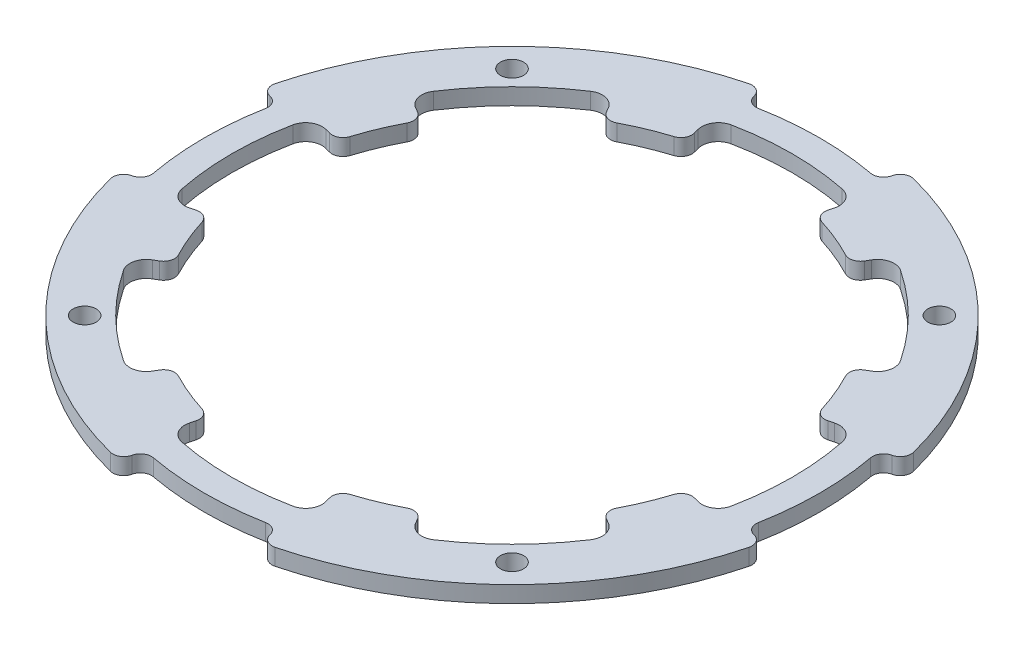
from build123d import *

# Parameters (mm, degrees)
SKETCH1_R                       = 60
SKETCH1_R_2                     = 45
BOSS_EXTRUDE1_DEPTH             = 3
CUT_EXTRUDE1_DEPTH              = 85.905830189
CIRPATTERN1_COUNT               = 8
SKETCH3_R                       = 2.1
CUT_EXTRUDE2_DEPTH              = 85.905830189
CIRPATTERN2_COUNT               = 4
SCHNITT_LINEAR_AUSTRAGEN1_DEPTH = 85.905830189
VERRUNDUNG2_R                   = 2
KREISMUSTER7_COUNT              = 4
VERRUNDUNG2_OF_KREISMUSTER7_R   = 2


with BuildPart() as part:
    # Sketch1 → Boss-Extrude1 (new body)
    with BuildSketch(Plane(origin=(0, 0, 0), x_dir=(1, 0, 0), z_dir=(0, 1, 0))):
        with Locations(Location((0, 0, 0), (0, 0, 270))):
            Circle(SKETCH1_R)
        with Locations(Location((0, 0, 0), (0, 0, 270))):
            Circle(SKETCH1_R_2, mode=Mode.SUBTRACT)
    extrude(amount=BOSS_EXTRUDE1_DEPTH)

    # Sketch2 → Cut-Extrude1 (cut, through all)
    with BuildSketch(Plane(origin=(0, 3, 0), x_dir=(1, 0, 0), z_dir=(0, 1, 0))):
        with BuildLine():
            Line((12.399026137, 46.273795509), (12.153476553, 45.357391985))
            ThreePointArc((12.153476553, 45.357391985), (12.332388249, 43.876840862), (13.485952537, 42.931679261))
            Line((13.485952537, 42.931679261), (-13.485952537, 42.931679261))
            ThreePointArc((-13.485952537, 42.931679261), (-12.332388249, 43.876840862), (-12.153476553, 45.357391985))
            Line((-12.153476553, 45.357391985), (-12.399026137, 46.273795509))
            ThreePointArc((-12.399026137, 46.273795509), (-12.051156799, 48.63074892), (-10.0950767, 49.990893435))
            ThreePointArc((-10.0950767, 49.990893435), (0, 51), (10.0950767, 49.990893435))
            ThreePointArc((10.0950767, 49.990893435), (12.051156799, 48.63074892), (12.399026137, 46.273795509))
        make_face()
    cut_extrude1 = extrude(amount=-CUT_EXTRUDE1_DEPTH, mode=Mode.SUBTRACT)

    # CirPattern1: Cut-Extrude1 ×8 about axis
    cirpattern1_axis = Axis((0, 0, 0), (0, 1, 0))
    for i in range(1, CIRPATTERN1_COUNT):
        add(cut_extrude1.rotate(cirpattern1_axis, i * 360 / CIRPATTERN1_COUNT), mode=Mode.SUBTRACT)

    # Sketch3 → Cut-Extrude2 (cut, through all)
    with BuildSketch(Plane(origin=(0, 3, 0), x_dir=(1, 0, 0), z_dir=(0, 1, 0))):
        with Locations(Location((38.890872965, 38.890872965, 0), (0, 0, 270))):
            Circle(SKETCH3_R)
    cut_extrude2 = extrude(amount=-CUT_EXTRUDE2_DEPTH, mode=Mode.SUBTRACT)

    # CirPattern2: Cut-Extrude2 ×4 about axis
    cirpattern2_axis = Axis((0, 0, 0), (0, 1, 0))
    for i in range(1, CIRPATTERN2_COUNT):
        add(cut_extrude2.rotate(cirpattern2_axis, i * 360 / CIRPATTERN2_COUNT), mode=Mode.SUBTRACT)

    # Skizze1 → Schnitt-Linear austragen1 (cut, through all)
    with BuildSketch(Plane(origin=(0, 3, 0), x_dir=(1, 0, 0), z_dir=(0, 1, 0))):
        with BuildLine():
            Line((-12.986376836, 58.577760427), (-12.120618381, 54.672576399))
            ThreePointArc((-12.120618381, 54.672576399), (0, 56), (12.120618381, 54.672576399))
            Line((12.120618381, 54.672576399), (12.986376836, 58.577760427))
            ThreePointArc((12.986376836, 58.577760427), (0, 60), (-12.986376836, 58.577760427))
        make_face()
    schnitt_linear_austragen1 = extrude(amount=-SCHNITT_LINEAR_AUSTRAGEN1_DEPTH, mode=Mode.SUBTRACT)

    # Verrundung2
    verrundung2_edges = [part.edges().sort_by_distance(p)[0] for p in [
        (-12.986376836, 1.5, -58.577760427),
        (-12.120618381, 1.5, -54.672576399),
        (12.986376836, 1.5, -58.577760427),
        (12.120618381, 1.5, -54.672576399),
    ]]
    fillet(verrundung2_edges, radius=VERRUNDUNG2_R - 0.0001)  # a hair under: the kernel refuses the full size

    # Kreismuster7: Schnitt-Linear austragen1 ×4 about axis
    kreismuster7_axis = Axis((0, 0, 0), (0, 1, 0))
    for i in range(1, KREISMUSTER7_COUNT):
        add(schnitt_linear_austragen1.rotate(kreismuster7_axis, i * 360 / KREISMUSTER7_COUNT), mode=Mode.SUBTRACT)

    # Verrundung2 of Kreismuster7
    verrundung2_of_kreismuster7_edges = [part.edges().sort_by_distance(p)[0] for p in [
        (-58.577760427, 1.5, 12.986376836),
        (-54.672576399, 1.5, 12.120618381),
        (-58.577760427, 1.5, -12.986376836),
        (-54.672576399, 1.5, -12.120618381),
        (12.986376836, 1.5, 58.577760427),
        (12.120618381, 1.5, 54.672576399),
        (-12.986376836, 1.5, 58.577760427),
        (-12.120618381, 1.5, 54.672576399),
        (58.577760427, 1.5, -12.986376836),
        (54.672576399, 1.5, -12.120618381),
        (58.577760427, 1.5, 12.986376836),
        (54.672576399, 1.5, 12.120618381),
    ]]
    fillet(verrundung2_of_kreismuster7_edges, radius=VERRUNDUNG2_OF_KREISMUSTER7_R - 0.0001)  # a hair under: the kernel refuses the full size


solid = part.part
